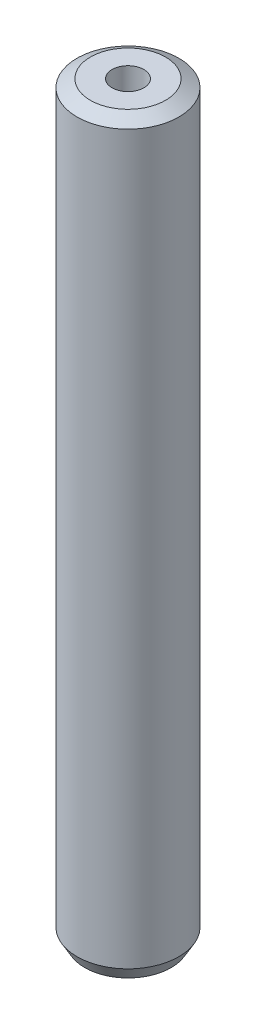
from build123d import *
from OCP.BRepFilletAPI import BRepFilletAPI_MakeChamfer

# Parameters (mm, degrees)
SKETCH1_R           = 20
BOSS_EXTRUDE1_DEPTH = 293.747996279
SKETCH2_R           = 6.240334104
CUT_EXTRUDE1_DEPTH  = 296.106566037
CHAMFER1_SIZE       = 3.035956921
CHAMFER1_SIZE2      = 5.258431637


with BuildPart() as part:
    # Sketch1 → Boss-Extrude1 (new body)
    with BuildSketch(Plane(origin=(0, 0, 0), x_dir=(1, 0, 0), z_dir=(0, 1, 0))):
        Circle(SKETCH1_R)
    extrude(amount=BOSS_EXTRUDE1_DEPTH)

    # Sketch2 → Cut-Extrude1 (cut, through all)
    with BuildSketch(Plane(origin=(0, 0, 0), x_dir=(1, 0, 0), z_dir=(0, 1, 0))):
        Circle(SKETCH2_R)
    extrude(amount=CUT_EXTRUDE1_DEPTH, mode=Mode.SUBTRACT)

    # Chamfer1: one chamfer whose edges measure the first distance from different faces: ONE call of the kernel's chamfer builder (chamfer() names one face for all edges)
    chamfer1_edges_1 = [part.edges().sort_by_distance(p)[0] for p in [
        (-20, 293.747996279, 0),
    ]]
    chamfer1_side_1 = [part.faces().sort_by_distance(p)[0] for p in [
        (-20, 146.873998139, 0),
    ]]
    chamfer1_edges_2 = [part.edges().sort_by_distance(p)[0] for p in [
        (-20, 0, 0),
    ]]
    chamfer1_side_2 = [part.faces().sort_by_distance(p)[0] for p in [
        (-19.434314575, 0, 0),
    ]]
    chamfer1 = BRepFilletAPI_MakeChamfer(part.part.solid().wrapped)
    for e in chamfer1_edges_1:
        chamfer1.Add(CHAMFER1_SIZE, CHAMFER1_SIZE2, e.wrapped, chamfer1_side_1[0].wrapped)  # the first distance lies on this face
    for e in chamfer1_edges_2:
        chamfer1.Add(CHAMFER1_SIZE, CHAMFER1_SIZE2, e.wrapped, chamfer1_side_2[0].wrapped)  # the first distance lies on this face
    add(Compound.cast(chamfer1.Shape()), mode=Mode.REPLACE)


solid = part.part
